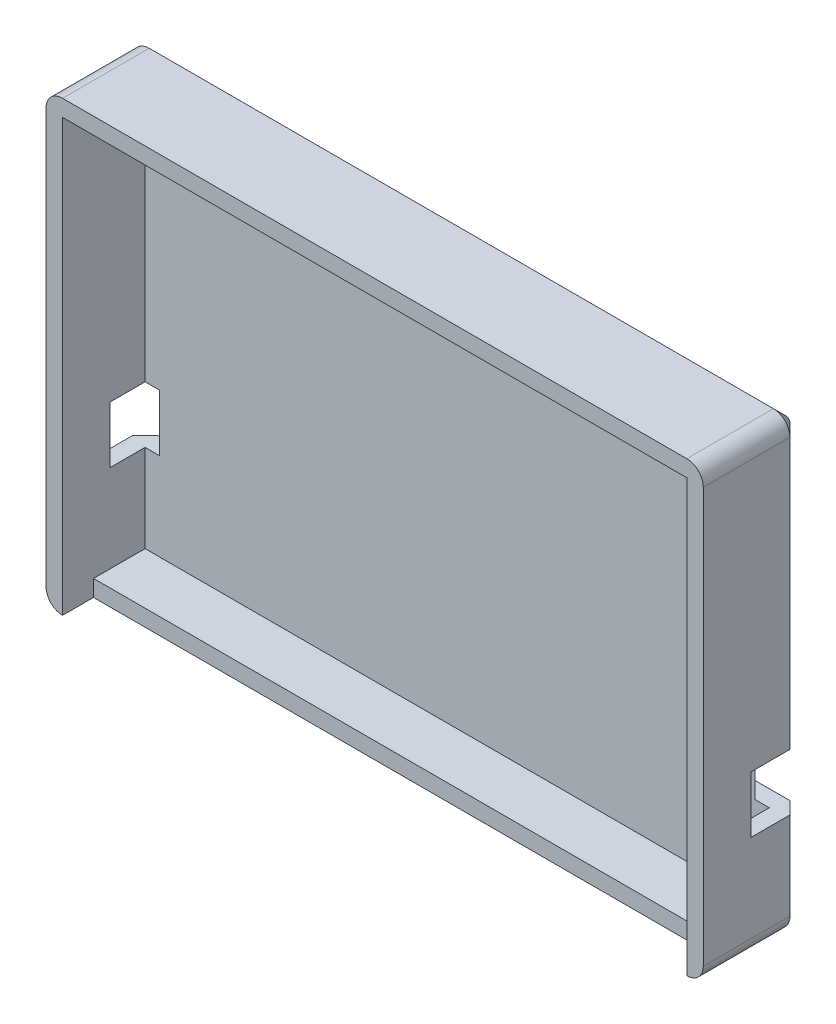
from build123d import *

# Parameters (mm, degrees)
SKETCH1_W           = 63.7
SKETCH1_H           = 43.4
BOSS_EXTRUDE1_DEPTH = 1.6
SKETCH2_W           = 63.7
SKETCH2_H           = 43.4
SKETCH2_W_2         = 60.5
SKETCH2_H_2         = 40.2
BOSS_EXTRUDE2_DEPTH = 8
SKETCH4_W           = 60.5
SKETCH4_H           = 3
CUT_EXTRUDE1_DEPTH  = 54.421180257
SKETCH5_W           = 2.6
SKETCH5_H           = 5.5
CUT_EXTRUDE2_DEPTH  = 5
CHAMFER1_SIZE       = 2
FILLET1_R           = 1.6
CHAMFER2_SIZE       = 1.2


with BuildPart() as part:
    # Sketch1 → Boss-Extrude1 (new body)
    with BuildSketch(Plane.XY):
        Rectangle(SKETCH1_W, SKETCH1_H)
    extrude(amount=BOSS_EXTRUDE1_DEPTH)

    # Sketch2 → Boss-Extrude2 (add)
    with BuildSketch(Plane.XY.offset(1.6)):
        Rectangle(SKETCH2_W, SKETCH2_H)
        Rectangle(SKETCH2_W_2, SKETCH2_H_2, mode=Mode.SUBTRACT)
    extrude(amount=BOSS_EXTRUDE2_DEPTH)

    # Sketch4 → Cut-Extrude1 (cut, through all)
    with BuildSketch(Plane(origin=(0, -20.1, 0), x_dir=(1, 0, 0), z_dir=(0, 1, 0))):
        with Locations((0, -8.1)):
            Rectangle(SKETCH4_W, SKETCH4_H)
    extrude(amount=-CUT_EXTRUDE1_DEPTH, mode=Mode.SUBTRACT)

    # Sketch5 → Cut-Extrude2 (cut)
    with BuildSketch(Plane(origin=(0, 0, 0), x_dir=(-1, 0, 0), z_dir=(0, 0, -1))):
        with Locations((-30.55, -8.85)):
            Rectangle(SKETCH5_W, SKETCH5_H)
        with Locations((30.55, -8.85)):
            Rectangle(SKETCH5_W, SKETCH5_H)
    extrude(amount=-CUT_EXTRUDE2_DEPTH, mode=Mode.SUBTRACT)

    # Chamfer1
    # the kernel refuses this chamfer: 2 mm, written as the material it takes off along each edge
    with BuildSketch(Plane(origin=(-29.25, -6.1, 0), x_dir=(0.9996219169112968, 0, -0.02749587661058639), z_dir=(0, -1, 0))) as chamfer1_piece_1:
        Polygon((CHAMFER1_SIZE * 0.999621916911, CHAMFER1_SIZE * 0.0274958766106), (-CHAMFER1_SIZE * 0.0274958766106, CHAMFER1_SIZE * 0.999621916911), (0, 0), align=None)
    extrude(amount=5.5, mode=Mode.SUBTRACT)
    with BuildSketch(Plane(origin=(29.25, -6.1, 0), x_dir=(-0.9996219169112968, 0, -0.02749587661058639), z_dir=(0, -1, 0))) as chamfer1_piece_2:
        Polygon((CHAMFER1_SIZE * 0.999621916911, -CHAMFER1_SIZE * 0.0274958766106), (-CHAMFER1_SIZE * 0.0274958766106, -CHAMFER1_SIZE * 0.999621916911), (0, 0), align=None)
    extrude(amount=5.5, mode=Mode.SUBTRACT)

    # Fillet1
    fillet1_edges = [part.edges().sort_by_distance(p)[0] for p in [
        (-31.85, 21.7, 4.8),
        (-31.85, -21.7, 4.8),
        (31.85, -21.7, 4.8),
        (31.85, 21.7, 4.8),
    ]]
    fillet(fillet1_edges, radius=FILLET1_R)

    # Chamfer2
    chamfer2_edges = [part.edges().sort_by_distance(p)[0] for p in [
        (-31.85, 7, 0),
        (0, 21.7, 0),
        (31.85, -15.85, 0),
        (0, -21.7, 0),
        (31.38137085, 21.23137085, 0),
        (31.38137085, -21.23137085, 0),
        (-31.38137085, -21.23137085, 0),
        (-31.38137085, 21.23137085, 0),
        (-31.85, -15.85, 0),
        (31.85, 7, 0),
    ]]
    chamfer(chamfer2_edges, length=CHAMFER2_SIZE)


solid = part.part
